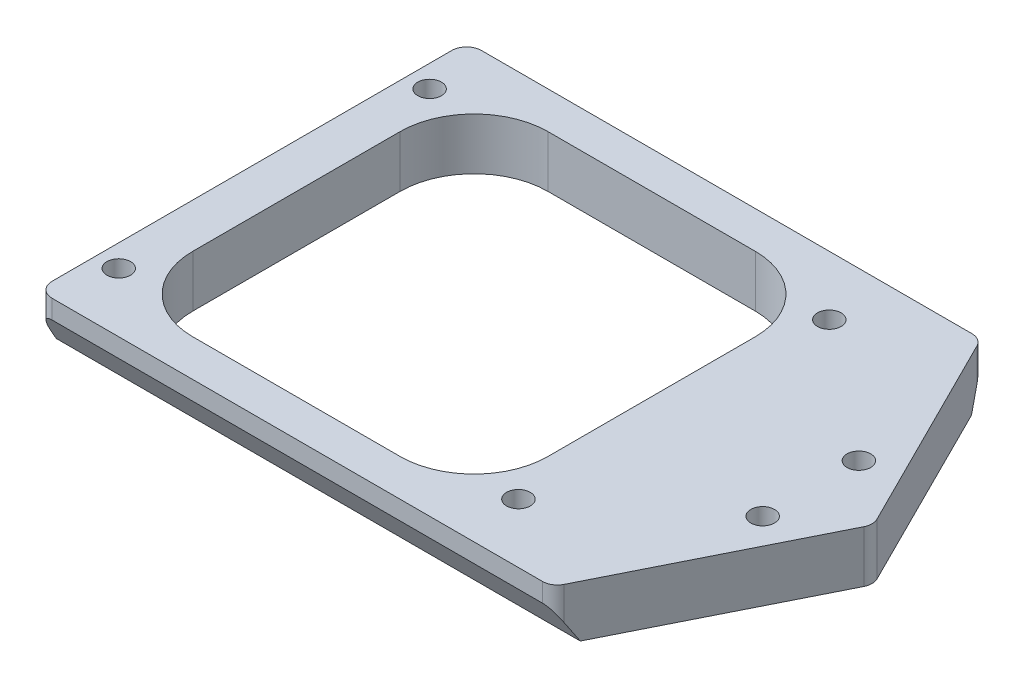
from build123d import *

# Parameters (mm, degrees)
BOSS_EXTRUDE1_DEPTH     = 1.75
CUT_EXTRUDE1_DEPTH      = 52.069193258
CUT_EXTRUDE1_DEPTH_BACK = 52.069193258
SKETCH2_W               = 24
SKETCH2_H               = 24
FILLET1_R               = 5
M2X0_4_TAPPED_HOLE1_D   = 1.6
FILLET2_R               = 1
SKETCH11_W              = 39.153964454
SKETCH11_H              = 3.647114317
CUT_EXTRUDE2_DEPTH      = 51.858555782


with BuildPart() as part:
    # Sketch1 → Boss-Extrude1 (new, symmetric)
    with BuildSketch(Plane(origin=(0, 0, 0), x_dir=(1, 0, 0), z_dir=(0, 1, 0))):
        Polygon((0, 0), (34.748434417, 0), (42, 14.5), (34.748434417, 29), (0, 29), align=None)
    extrude(amount=BOSS_EXTRUDE1_DEPTH, both=True)

    # Sketch2 → Cut-Extrude1 (cut, two sides: drawn at the far end of the back side and taken through both)
    with BuildSketch(Plane(origin=(0, 0, 0), x_dir=(1, 0, 0), z_dir=(0, 1, 0)).offset(-CUT_EXTRUDE1_DEPTH_BACK)):
        with Locations((15, 14.5)):
            Rectangle(SKETCH2_W, SKETCH2_H)
    extrude(amount=CUT_EXTRUDE1_DEPTH + CUT_EXTRUDE1_DEPTH_BACK, mode=Mode.SUBTRACT)

    # Fillet1
    fillet1_edges = [part.edges().sort_by_distance(p)[0] for p in [
        (3, 0, -26.5),
        (27, 0, -26.5),
        (27, 0, -2.5),
        (3, 0, -2.5),
    ]]
    fillet(fillet1_edges, radius=FILLET1_R)

    # M2x0.4 Tapped Hole1 (through all)
    with Locations(Plane(origin=(1.5, 1.75, -25), x_dir=(0, 0, 1), z_dir=(0, 1, 0))):
        with Locations((0, 0), (0, 27), (7.25, 36.248434417), (13.75, 36.248434417), (21, 27), (21, 0)):
            Hole(M2X0_4_TAPPED_HOLE1_D / 2)

    # Fillet2
    fillet2_edges = [part.edges().sort_by_distance(p)[0] for p in [
        (0, 0, -29),
        (34.748434417, 0, -29),
        (42, 0, -14.5),
        (34.748434417, 0, 0),
        (0, 0, 0),
    ]]
    fillet(fillet2_edges, radius=FILLET2_R)

    # Sketch11 → Cut-Extrude2 (cut, through all)
    with BuildSketch(Plane(origin=(0, 0.119868355, -0.207618081), x_dir=(1, 0, 0), z_dir=(9.104401052367775e-15, -0.5000000000000047, 0.866025403784436))):
        with Locations((19.576982227, -0.335580838)):
            Rectangle(SKETCH11_W, SKETCH11_H)
    cut_extrude2 = extrude(amount=CUT_EXTRUDE2_DEPTH, mode=Mode.SUBTRACT)

    # Mirror1: Cut-Extrude2 across plane
    add(cut_extrude2.mirror(Plane(origin=(0, 0, -14.5), x_dir=(1, 0, 0), z_dir=(0, 0, -1))), mode=Mode.SUBTRACT)


solid = part.part
